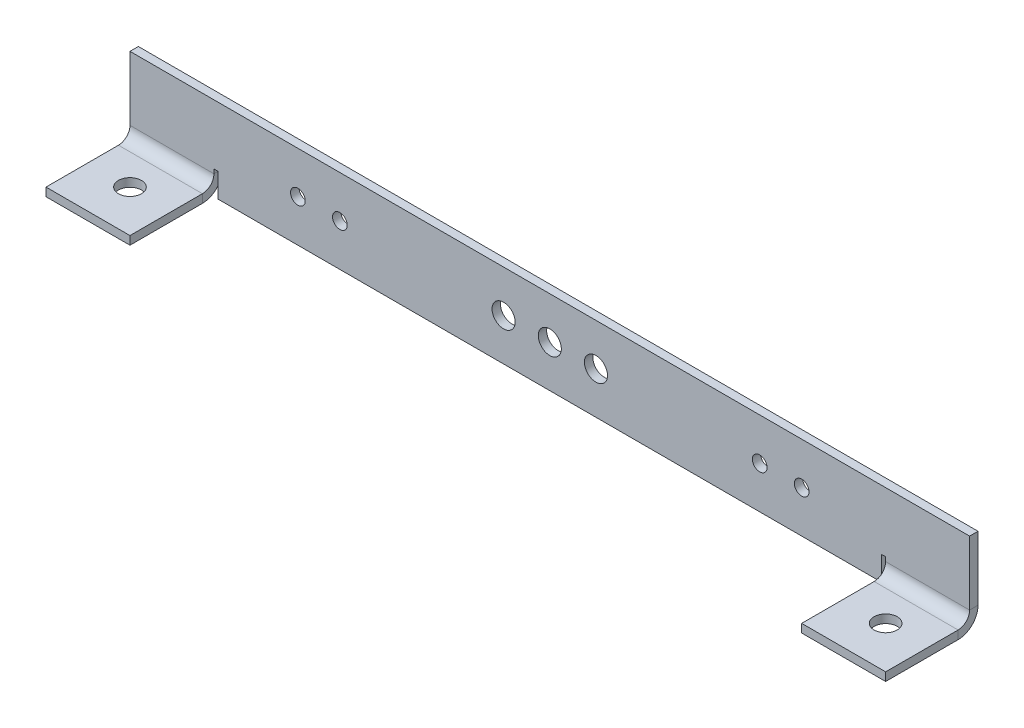
from build123d import *

# Parameters (mm, degrees)
SKETCH_1_W                        = 200
SKETCH_1_H                        = 20
SM_BASE_FLANGE_1_DEPTH            = 2
SM_EDGE_FLANGE_1_STRIP_W          = 13.4732
SM_EDGE_FLANGE_1_STRIP_H          = 2
SM_EDGE_FLANGE_1_STRIP_CUT_DEPTH  = 20
SM_EDGE_FLANGE_1_RELIEF_W         = 14.4732
SM_EDGE_FLANGE_1_RELIEF_H         = 1
SM_EDGE_FLANGE_1_RELIEF_CUT_DEPTH = 2
SM_EDGE_FLANGE_1_DEPTH            = 20
SKETCH_10_R                       = 2.75
CUT_EXTRUDE_2_DEPTH               = 10
SKETCH_11_R                       = 2.75
SKETCH_11_R_2                     = 1.75
CUT_EXTRUDE_3_DEPTH               = 10


# Sheet-metal steps are written as plain solids
with BuildPart() as part:
    # Sketch 1 → 基体-法兰1 (new body)
    with BuildSketch(Plane.XY):
        with Locations((0, -10)):
            Rectangle(SKETCH_1_W, SKETCH_1_H)
    extrude(amount=-SM_BASE_FLANGE_1_DEPTH)

    # 边线-法兰1 strip (across the edge) → 边线-法兰1 strip cut (cut)
    with BuildSketch(Plane(origin=(-100, -20, 0), x_dir=(0, 1, 0), z_dir=(1, 0, 0))):
        with Locations((-2, -1)):
            Rectangle(SM_EDGE_FLANGE_1_STRIP_W, SM_EDGE_FLANGE_1_STRIP_H)
    sm_edge_flange_1_strip_cut = extrude(amount=SM_EDGE_FLANGE_1_STRIP_CUT_DEPTH, mode=Mode.SUBTRACT)

    # 边线-法兰1 relief (on the sheet) → 边线-法兰1 relief cut (cut)
    with BuildSketch(Plane(origin=(-100, -15.2634, 0), x_dir=(0, 1, 0), z_dir=(0, 0, 1))):
        with Locations((-6.2366, -20.5)):
            Rectangle(SM_EDGE_FLANGE_1_RELIEF_W, SM_EDGE_FLANGE_1_RELIEF_H)
    sm_edge_flange_1_relief_cut = extrude(amount=-SM_EDGE_FLANGE_1_RELIEF_CUT_DEPTH, mode=Mode.SUBTRACT)

    # 边线-法兰1 section (across the edge) → 边线-法兰1 (add)
    with BuildSketch(Plane(origin=(-100, -20, 0), x_dir=(0, 1, 0), z_dir=(1, 0, 0))):
        with BuildLine():
            Line((0, 2.7366), (0, 20))
            Line((0, 20), (2, 20))
            Line((2, 20), (2, 2.7366))
            ThreePointArc((2, 2.7366), (2.801531583, 0.801531583), (4.7366, 0))
            Line((4.7366, 0), (4.7366, -2))
            ThreePointArc((4.7366, -2), (1.38731802, -0.61268198), (0, 2.7366))
        make_face()
    sm_edge_flange_1 = extrude(amount=SM_EDGE_FLANGE_1_DEPTH)

    # 草图10 → 切除-拉伸2 (cut)
    with BuildSketch(Plane(origin=(0, -18, 0), x_dir=(1, 0, 0), z_dir=(0, 1, 0))):
        with Locations(Location((-90, -10, 0), (0, 0, 270))):
            Circle(SKETCH_10_R)
    cut_extrude_2 = extrude(amount=-CUT_EXTRUDE_2_DEPTH, mode=Mode.SUBTRACT)

    # 镜向1: 边线-法兰1 strip cut, 边线-法兰1 relief cut, 边线-法兰1, 切除-拉伸2 across plane
    add(sm_edge_flange_1_strip_cut.mirror(Plane(origin=(0, 0, 0), x_dir=(0, 0, 1), z_dir=(1, 0, 0))), mode=Mode.SUBTRACT)
    add(sm_edge_flange_1_relief_cut.mirror(Plane(origin=(0, 0, 0), x_dir=(0, 0, 1), z_dir=(1, 0, 0))), mode=Mode.SUBTRACT)
    add(sm_edge_flange_1.mirror(Plane(origin=(0, 0, 0), x_dir=(0, 0, 1), z_dir=(1, 0, 0))))
    add(cut_extrude_2.mirror(Plane(origin=(0, 0, 0), x_dir=(0, 0, 1), z_dir=(1, 0, 0))), mode=Mode.SUBTRACT)

    # 草图11 → 切除-拉伸3 (cut)
    with BuildSketch(Plane(origin=(0, 0, -2), x_dir=(-1, 0, 0), z_dir=(0, 0, -1))):
        with Locations((0, -10)):
            Circle(SKETCH_11_R)
        with Locations((-11, -10)):
            Circle(SKETCH_11_R)
        with Locations(Location((11, -10, 0), (0, 0, 180))):
            Circle(SKETCH_11_R)
        with Locations((-60, -10)):
            Circle(SKETCH_11_R_2)
        with Locations((-50, -10)):
            Circle(SKETCH_11_R_2)
        with Locations(Location((60, -10, 0), (0, 0, 180))):
            Circle(SKETCH_11_R_2)
        with Locations(Location((50, -10, 0), (0, 0, 180))):
            Circle(SKETCH_11_R_2)
    extrude(amount=-CUT_EXTRUDE_3_DEPTH, mode=Mode.SUBTRACT)


solid = part.part
